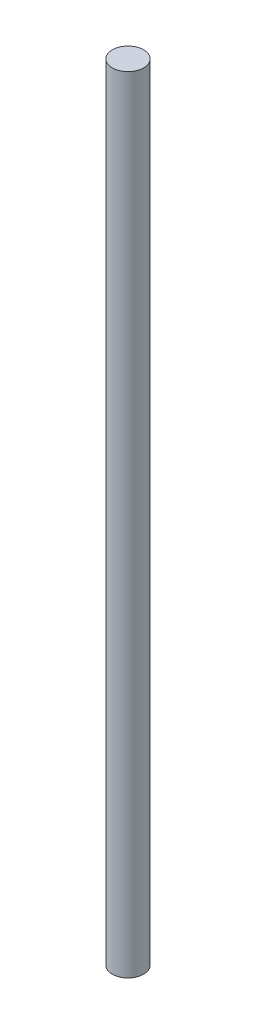
from build123d import *

# Parameters (mm, degrees)
SKETCH1_R           = 4
BOSS_EXTRUDE1_DEPTH = 100


with BuildPart() as part:
    # Sketch1 → Boss-Extrude1 (new, symmetric)
    with BuildSketch(Plane(origin=(0, 0, 0), x_dir=(1, 0, 0), z_dir=(0, 1, 0))):
        Circle(SKETCH1_R)
    extrude(amount=BOSS_EXTRUDE1_DEPTH, both=True)


solid = part.part
